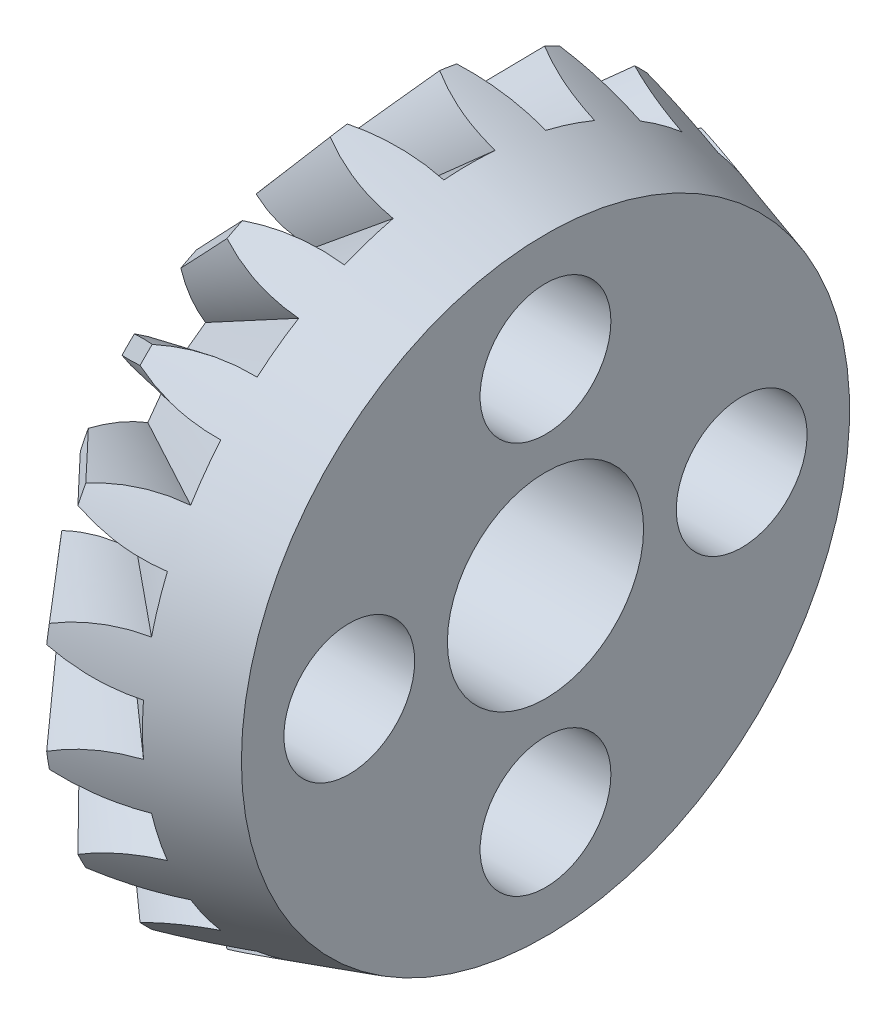
from build123d import *

# Parameters (mm, degrees)
CIRPATTERN1_COUNT   = 20
SKETCH_1_R          = 8
SKETCH_1_R_2        = 3
CUT_EXTRUDE_1_DEPTH = 7
SKETCH_2_R          = 2
CUT_EXTRUDE_2_DEPTH = 17.815122352


with BuildPart() as part:
    # Sketch1 → Revolve1 (revolve)
    with BuildSketch(Plane.XY):
        Polygon((0, 3), (14.6, 3), (14.6, 8), (7.6, 8), (7.6, 9.3), (2.951475221, 10.7), (0, 7.303119958), align=None)
    revolve(axis=Axis((0, 0, 0), (1, 0, 0)))

    # Sketch6 for Cut-Loft1 → Cut-Loft1 section 0
    with BuildSketch(Plane(origin=(5.27573761, 0, 0), x_dir=(0, 0, -1), z_dir=(1, 0, 0))):
        with BuildLine():
            Line((-5.214961125, 16.05), (5.214961125, 16.05))
            # circular arc as an exact rational Bezier (weights 1, cos(half-angle), 1)
            Bezier((5.214961125, 16.05), (1.131031442, 14.371117063), (0.784590957, 9.969173337), weights=[1, 0.851943225, 1])
            Bezier((0.784590957, 9.969173337), (0, 10.030921985), (-0.784590957, 9.969173337), weights=[1, 0.996917334, 1])
            Bezier((-0.784590957, 9.969173337), (-1.131031442, 14.371117063), (-5.214961125, 16.05), weights=[1, 0.851943225, 1])
        make_face()
    # Sketch5 for Cut-Loft1 → Cut-Loft1 section 1
    with BuildSketch(Plane.ZY):
        with BuildLine():
            Line((-0.419756162, 5.333507735), (0.419756162, 5.333507735))
            Bezier((0.419756162, 5.333507735), (0.6664631, 8.468216601), (3.30648184, 10.176304724), weights=[1, 0.896497279, 1])
            Bezier((3.30648184, 10.176304724), (0, 11.250645799), (-3.30648184, 10.176304724), weights=[1, 0.951056516, 1])
            Bezier((-3.30648184, 10.176304724), (-0.6664631, 8.468216601), (-0.419756162, 5.333507735), weights=[1, 0.896497279, 1])
        make_face()
    cut_loft1 = loft(mode=Mode.SUBTRACT)

    # CirPattern1: Cut-Loft1 ×20 about axis
    cirpattern1_axis = Axis((0, 0, 0), (-1, 0, 0))
    for i in range(1, CIRPATTERN1_COUNT):
        add(cut_loft1.rotate(cirpattern1_axis, i * 360 / CIRPATTERN1_COUNT), mode=Mode.SUBTRACT)

    # 草图1 → 切除-拉伸1 (cut)
    with BuildSketch(Plane(origin=(14.6, 0, 0), x_dir=(0, 0, -1), z_dir=(1, 0, 0))):
        Circle(SKETCH_1_R)
        Circle(SKETCH_1_R_2, mode=Mode.SUBTRACT)
    extrude(amount=-CUT_EXTRUDE_1_DEPTH, mode=Mode.SUBTRACT)

    # 草图2 → 切除-拉伸2 (cut, through all)
    with BuildSketch(Plane(origin=(7.6, 0, 0), x_dir=(0, 0, -1), z_dir=(1, 0, 0))):
        with Locations((0, 6)):
            Circle(SKETCH_2_R)
        with Locations((-6, 0)):
            Circle(SKETCH_2_R)
        with Locations((0, -6)):
            Circle(SKETCH_2_R)
        with Locations((6, 0)):
            Circle(SKETCH_2_R)
    extrude(amount=-CUT_EXTRUDE_2_DEPTH, mode=Mode.SUBTRACT)


solid = part.part
